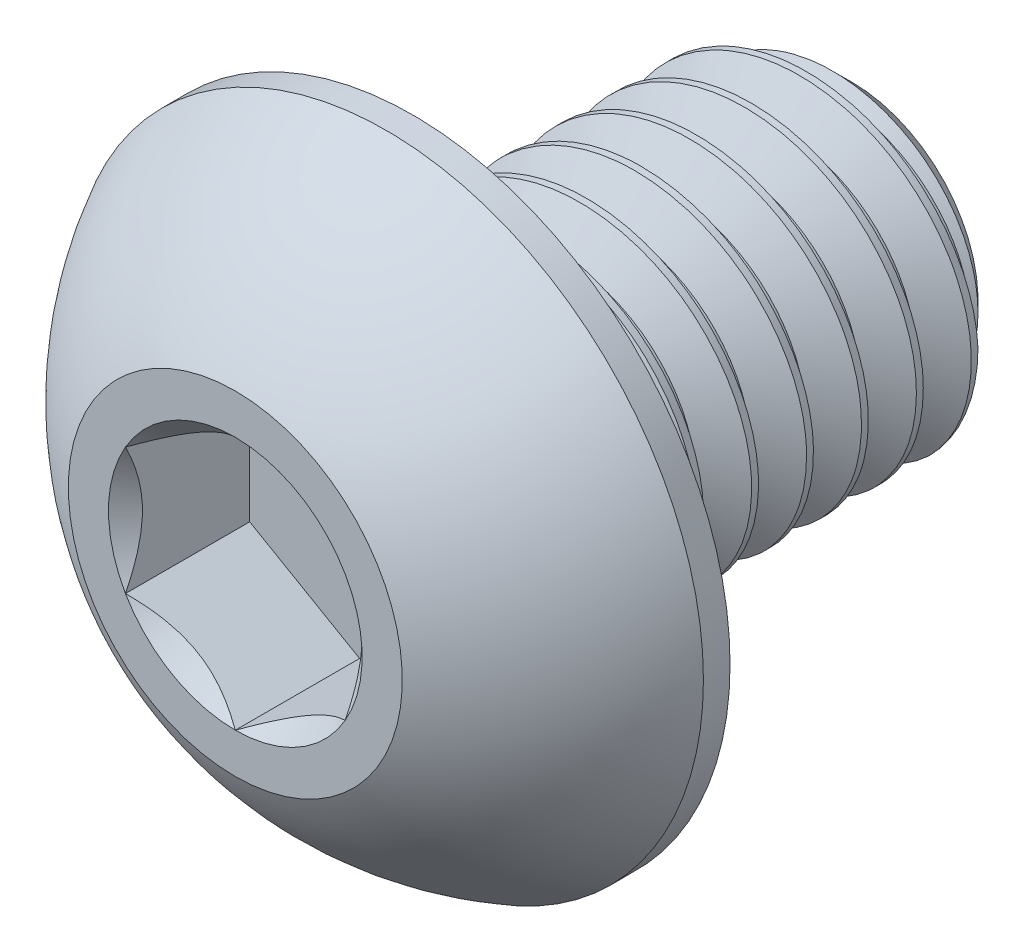
from build123d import *

# Parameters (mm, degrees)
SKETCH1_W          = 6.35
SKETCH1_H          = 2.413
CHAMFER1_SIZE      = 0.5953125
CUT_SWEEP1_PITCH   = 0.79375
CUT_EXTRUDE2_DEPTH = 1.79578
SKETCH6_R          = 1.833087105
CUT_EXTRUDE3_DEPTH = 1.79578
CUT_EXTRUDE3_TAPER = 45


with BuildPart() as part:
    # Sketch1 → Revolve1 (revolve)
    with BuildSketch(Plane(origin=(0, 0, 0), x_dir=(0, 0, -1), z_dir=(1, 0, 0))):
        with Locations((5.7404, 1.2065)):
            Rectangle(SKETCH1_W, SKETCH1_H)
    revolve(axis=Axis((0, 0, -8.9154), (0, 0, 1)))

    # Chamfer1
    chamfer1_edges = [part.edges().sort_by_distance(p)[0] for p in [
        (0, -2.413, -8.9154),
    ]]
    chamfer(chamfer1_edges, length=CHAMFER1_SIZE)

    # Cut-Sweep1: the profile of Sketch2 profile screwed along a right-hand helix of 9 turns, 8 arcs to a turn; built about Z, then put on its axis
    cut_sweep1_z = Axis((0, 0, 0), (0, 0, 1))
    cut_sweep1_corners = [(2.4133, 0, 0.000173205), (2.4133, 0, -0.694704455), (1.897444252, 0, -0.396875), (1.897444252, 0, -0.29765625)]
    with BuildLine(mode=Mode.PRIVATE) as cut_sweep1_profile:
        Line(cut_sweep1_corners[0], cut_sweep1_corners[1])
        Line(cut_sweep1_corners[1], cut_sweep1_corners[2])
        Line(cut_sweep1_corners[2], cut_sweep1_corners[3])
        Line(cut_sweep1_corners[3], cut_sweep1_corners[0])
    cut_sweep1_cap = Face(cut_sweep1_profile.wire())
    cut_sweep1_turn_angles = [0, 22.5, 45, 67.5, 90, 112.5, 135, 157.5, 180, 202.5, 225, 247.5, 270, 292.5, 315, 337.5, 360]
    cut_sweep1_turn_weights = [1, 0.9238795325112867, 1, 0.9238795325112867, 1, 0.9238795325112867, 1, 0.9238795325112867, 1, 0.9238795325112867, 1, 0.9238795325112867, 1, 0.9238795325112867, 1, 0.9238795325112867, 1]
    cut_sweep1_turn_rails = [Edge.make_bspline([Vector(p[0], p[1], 0).rotate(cut_sweep1_z, cut_sweep1_turn_angles[k]) / cut_sweep1_turn_weights[k] + Vector(0, 0, p[2] + CUT_SWEEP1_PITCH * cut_sweep1_turn_angles[k] / 360) for k in range(17)], [0, 0, 0, 1, 1, 2, 2, 3, 3, 4, 4, 5, 5, 6, 6, 7, 7, 8, 8, 8], 2, cut_sweep1_turn_weights) for p in cut_sweep1_corners]
    cut_sweep1_turn_sides = [Face.make_surface_from_curves(cut_sweep1_turn_rails[p[0]], cut_sweep1_turn_rails[p[1]]) for p in [(0, 1), (1, 2), (2, 3), (3, 0)]]
    cut_sweep1 = Plane(origin=(0, 0, -8.9154), x_dir=(0, 1, 0), z_dir=(0, 0, 1)) * Solid(Shell([*[p.moved(Location((0, 0, CUT_SWEEP1_PITCH * i))) for i in range(9) for p in cut_sweep1_turn_sides], cut_sweep1_cap, cut_sweep1_cap.rotate(cut_sweep1_z, 3240).moved(Location((0, 0, CUT_SWEEP1_PITCH * 3240 / 360)))]))
    add(cut_sweep1, mode=Mode.SUBTRACT)

    # Sketch7 → Revolve2 (revolve)
    with BuildSketch(Plane(origin=(0, 0, 0), x_dir=(0, 0, -1), z_dir=(1, 0, 0)), mode=Mode.PRIVATE) as revolve2_sk:
        with BuildLine():
            Line((2.18059, 4.5847), (2.5654, 4.5847))
            Line((2.5654, 4.5847), (2.5654, 0))
            Line((2.5654, 0), (0, 0))
            Line((0, 0), (0, 2.413))
            ThreePointArc((0, 2.413), (0.925030326, 3.664791196), (2.18059, 4.5847))
        make_face()
    revolve(revolve2_sk.sketch.rotate(Axis((0, 0, 0), (0, 0, -1)), 189.052465709), axis=Axis((0, 0, 0), (0, 0, -1)))

    # Sketch5 → Cut-Extrude2 (cut)
    with BuildSketch(Plane.XY):
        Polygon((1.5875, -0.916543552), (1.5875, 0.916543552), (0, 1.833087105), (-1.5875, 0.916543552), (-1.5875, -0.916543552), (0, -1.833087105), align=None)
    extrude(amount=-CUT_EXTRUDE2_DEPTH, mode=Mode.SUBTRACT)

    # Sketch6 → Cut-Extrude3 (cut)
    with BuildSketch(Plane.XY):
        Circle(SKETCH6_R)
    extrude(amount=-CUT_EXTRUDE3_DEPTH, taper=CUT_EXTRUDE3_TAPER, mode=Mode.SUBTRACT)


solid = part.part
